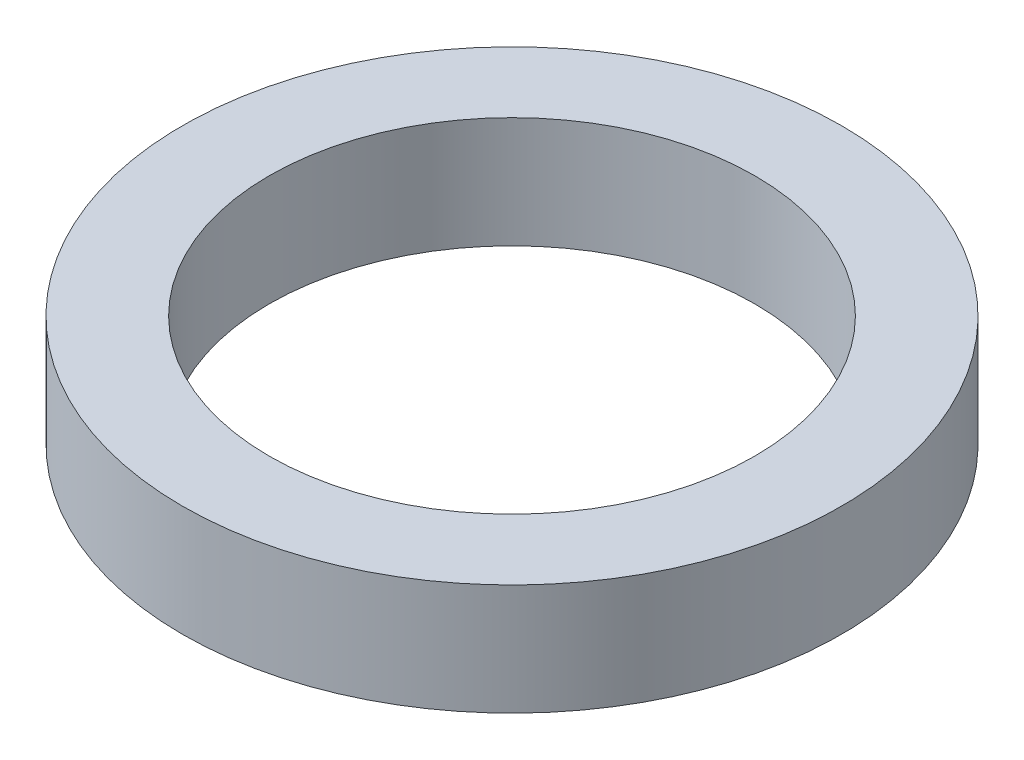
from build123d import *

# Parameters (mm, degrees)
SKETCH1_R           = 47.5
BOSS_EXTRUDE1_DEPTH = 16
SKETCH2_R           = 35
CUT_EXTRUDE1_DEPTH  = 70.054326439


with BuildPart() as part:
    # Sketch1 → Boss-Extrude1 (new body)
    with BuildSketch(Plane(origin=(0, 0, 0), x_dir=(1, 0, 0), z_dir=(0, 1, 0))):
        Circle(SKETCH1_R)
    extrude(amount=BOSS_EXTRUDE1_DEPTH)

    # Sketch2 → Cut-Extrude1 (cut, through all)
    with BuildSketch(Plane(origin=(0, 0, 0), x_dir=(1, 0, 0), z_dir=(0, 1, 0))):
        Circle(SKETCH2_R)
    extrude(amount=CUT_EXTRUDE1_DEPTH, mode=Mode.SUBTRACT)


solid = part.part
